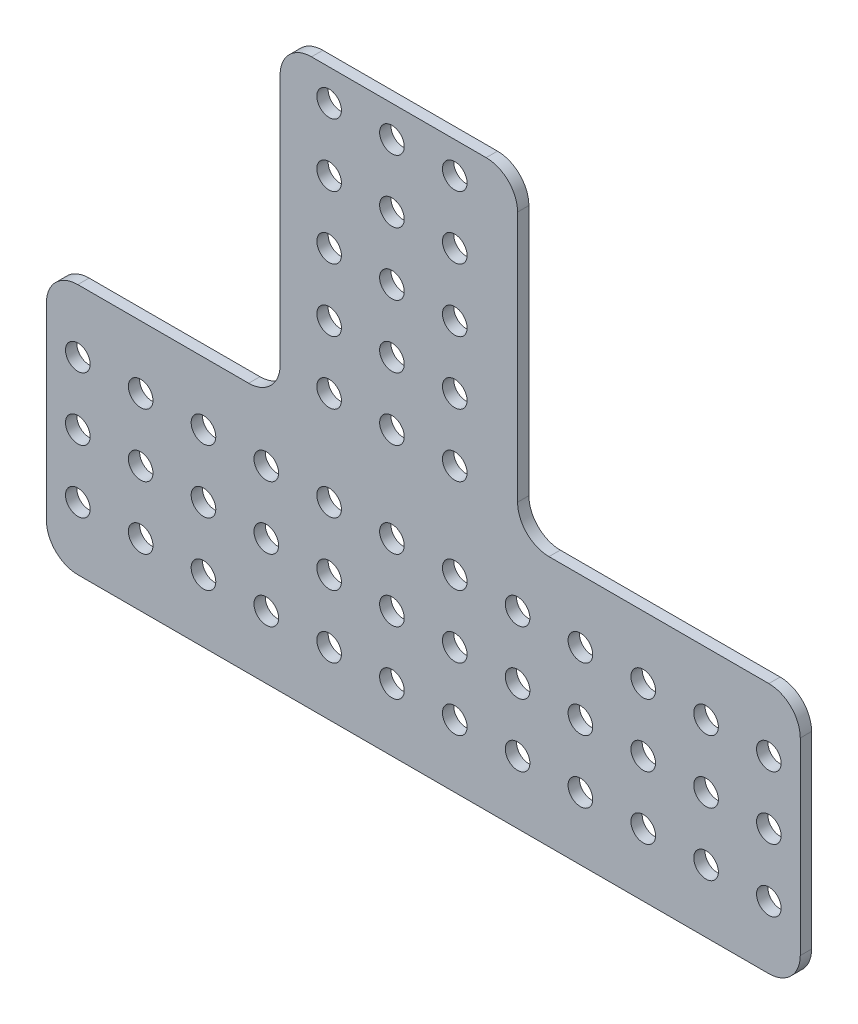
from build123d import *

# Parameters (mm, degrees)
SKETCH1_R           = 2.4892
BOSS_EXTRUDE1_DEPTH = 2.286


with BuildPart() as part:
    # Sketch1 → Boss-Extrude1 (new body)
    with BuildSketch(Plane.XY):
        with BuildLine():
            Line((-255.429010331, 188.842880428), (-220.118407496, 188.842880428))
            ThreePointArc((-220.118407496, 188.842880428), (-215.628279435, 186.983008489), (-213.768407496, 182.492880428))
            Line((-213.768407496, 182.492880428), (-213.768407496, 131.692880428))
            ThreePointArc((-213.768407496, 131.692880428), (-211.908535556, 127.202752368), (-207.418407496, 125.342880428))
            Line((-207.418407496, 125.342880428), (-162.968407496, 125.342880428))
            ThreePointArc((-162.968407496, 125.342880428), (-158.478279435, 123.483008489), (-156.618407496, 118.992880428))
            Line((-156.618407496, 118.992880428), (-156.618407496, 80.892880428))
            ThreePointArc((-156.618407496, 80.892880428), (-158.478279435, 76.402752368), (-162.968407496, 74.542880428))
            Line((-162.968407496, 74.542880428), (-302.668407496, 74.542880428))
            ThreePointArc((-302.668407496, 74.542880428), (-307.158535556, 76.402752368), (-309.018407496, 80.892880428))
            Line((-309.018407496, 80.892880428), (-309.018407496, 118.992880428))
            ThreePointArc((-309.018407496, 118.992880428), (-307.158535556, 123.483008489), (-302.668407496, 125.342880428))
            Line((-302.668407496, 125.342880428), (-268.129010331, 125.342880428))
            ThreePointArc((-268.129010331, 125.342880428), (-263.638882271, 127.202752368), (-261.779010331, 131.692880428))
            Line((-261.779010331, 131.692880428), (-261.779010331, 182.492880428))
            ThreePointArc((-261.779010331, 182.492880428), (-259.919138392, 186.983008489), (-255.429010331, 188.842880428))
        make_face()
        with Locations((-226.468407496, 157.092880428)):
            Circle(SKETCH1_R, mode=Mode.SUBTRACT)
        with Locations((-226.468407496, 144.392880428)):
            Circle(SKETCH1_R, mode=Mode.SUBTRACT)
        with Locations((-226.468407496, 131.692880428)):
            Circle(SKETCH1_R, mode=Mode.SUBTRACT)
        with Locations((-239.168407496, 131.692880428)):
            Circle(SKETCH1_R, mode=Mode.SUBTRACT)
        with Locations((-251.868407496, 131.692880428)):
            Circle(SKETCH1_R, mode=Mode.SUBTRACT)
        with Locations((-251.868407496, 144.392880428)):
            Circle(SKETCH1_R, mode=Mode.SUBTRACT)
        with Locations((-239.168407496, 144.392880428)):
            Circle(SKETCH1_R, mode=Mode.SUBTRACT)
        with Locations((-239.168407496, 157.092880428)):
            Circle(SKETCH1_R, mode=Mode.SUBTRACT)
        with Locations((-251.868407496, 157.092880428)):
            Circle(SKETCH1_R, mode=Mode.SUBTRACT)
        with Locations((-226.468407496, 169.792880428)):
            Circle(SKETCH1_R, mode=Mode.SUBTRACT)
        with Locations((-226.468407496, 182.492880428)):
            Circle(SKETCH1_R, mode=Mode.SUBTRACT)
        with Locations((-239.168407496, 182.492880428)):
            Circle(SKETCH1_R, mode=Mode.SUBTRACT)
        with Locations((-239.168407496, 169.792880428)):
            Circle(SKETCH1_R, mode=Mode.SUBTRACT)
        with Locations((-251.868407496, 169.792880428)):
            Circle(SKETCH1_R, mode=Mode.SUBTRACT)
        with Locations((-251.868407496, 182.492880428)):
            Circle(SKETCH1_R, mode=Mode.SUBTRACT)
        with Locations((-302.668407496, 112.642880428)):
            Circle(SKETCH1_R, mode=Mode.SUBTRACT)
        with Locations((-289.968407496, 112.642880428)):
            Circle(SKETCH1_R, mode=Mode.SUBTRACT)
        with Locations((-277.268407496, 112.642880428)):
            Circle(SKETCH1_R, mode=Mode.SUBTRACT)
        with Locations((-264.568407496, 112.642880428)):
            Circle(SKETCH1_R, mode=Mode.SUBTRACT)
        with Locations((-251.868407496, 112.642880428)):
            Circle(SKETCH1_R, mode=Mode.SUBTRACT)
        with Locations((-239.168407496, 112.642880428)):
            Circle(SKETCH1_R, mode=Mode.SUBTRACT)
        with Locations((-226.468407496, 112.642880428)):
            Circle(SKETCH1_R, mode=Mode.SUBTRACT)
        with Locations((-213.768407496, 112.642880428)):
            Circle(SKETCH1_R, mode=Mode.SUBTRACT)
        with Locations((-201.068407496, 112.642880428)):
            Circle(SKETCH1_R, mode=Mode.SUBTRACT)
        with Locations((-188.368407496, 112.642880428)):
            Circle(SKETCH1_R, mode=Mode.SUBTRACT)
        with Locations((-175.668407496, 112.642880428)):
            Circle(SKETCH1_R, mode=Mode.SUBTRACT)
        with Locations((-162.968407496, 112.642880428)):
            Circle(SKETCH1_R, mode=Mode.SUBTRACT)
        with Locations((-289.968407496, 99.942880428)):
            Circle(SKETCH1_R, mode=Mode.SUBTRACT)
        with Locations((-277.268407496, 99.942880428)):
            Circle(SKETCH1_R, mode=Mode.SUBTRACT)
        with Locations((-264.568407496, 99.942880428)):
            Circle(SKETCH1_R, mode=Mode.SUBTRACT)
        with Locations((-251.868407496, 99.942880428)):
            Circle(SKETCH1_R, mode=Mode.SUBTRACT)
        with Locations((-239.168407496, 99.942880428)):
            Circle(SKETCH1_R, mode=Mode.SUBTRACT)
        with Locations((-226.468407496, 99.942880428)):
            Circle(SKETCH1_R, mode=Mode.SUBTRACT)
        with Locations((-213.768407496, 99.942880428)):
            Circle(SKETCH1_R, mode=Mode.SUBTRACT)
        with Locations((-201.068407496, 99.942880428)):
            Circle(SKETCH1_R, mode=Mode.SUBTRACT)
        with Locations((-188.368407496, 99.942880428)):
            Circle(SKETCH1_R, mode=Mode.SUBTRACT)
        with Locations((-175.668407496, 99.942880428)):
            Circle(SKETCH1_R, mode=Mode.SUBTRACT)
        with Locations((-162.968407496, 99.942880428)):
            Circle(SKETCH1_R, mode=Mode.SUBTRACT)
        with Locations((-289.968407496, 87.242880428)):
            Circle(SKETCH1_R, mode=Mode.SUBTRACT)
        with Locations((-277.268407496, 87.242880428)):
            Circle(SKETCH1_R, mode=Mode.SUBTRACT)
        with Locations((-264.568407496, 87.242880428)):
            Circle(SKETCH1_R, mode=Mode.SUBTRACT)
        with Locations((-251.868407496, 87.242880428)):
            Circle(SKETCH1_R, mode=Mode.SUBTRACT)
        with Locations((-239.168407496, 87.242880428)):
            Circle(SKETCH1_R, mode=Mode.SUBTRACT)
        with Locations((-226.468407496, 87.242880428)):
            Circle(SKETCH1_R, mode=Mode.SUBTRACT)
        with Locations((-213.768407496, 87.242880428)):
            Circle(SKETCH1_R, mode=Mode.SUBTRACT)
        with Locations((-201.068407496, 87.242880428)):
            Circle(SKETCH1_R, mode=Mode.SUBTRACT)
        with Locations((-188.368407496, 87.242880428)):
            Circle(SKETCH1_R, mode=Mode.SUBTRACT)
        with Locations((-175.668407496, 87.242880428)):
            Circle(SKETCH1_R, mode=Mode.SUBTRACT)
        with Locations((-162.968407496, 87.242880428)):
            Circle(SKETCH1_R, mode=Mode.SUBTRACT)
        with Locations((-302.668407496, 99.942880428)):
            Circle(SKETCH1_R, mode=Mode.SUBTRACT)
        with Locations((-302.668407496, 87.242880428)):
            Circle(SKETCH1_R, mode=Mode.SUBTRACT)
    extrude(amount=BOSS_EXTRUDE1_DEPTH)


solid = part.part
